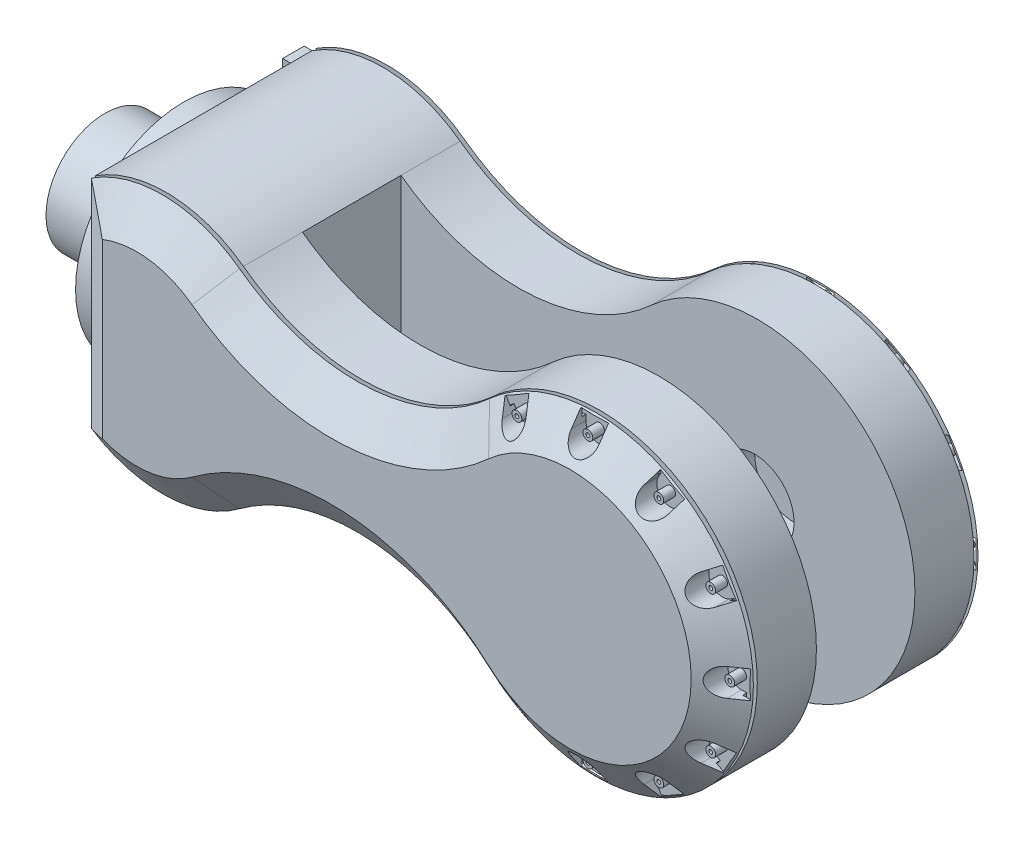
from build123d import *

# Parameters (mm, degrees)
SKETCH1_R           = 27.5
BOSS_EXTRUDE1_DEPTH = 5
BOSS_EXTRUDE2_DEPTH = 15
BOSS_EXTRUDE3_DEPTH = 1
BOSS_EXTRUDE4_DEPTH = 6.5
BOSS_EXTRUDE4_DRAFT = 55
CUT_EXTRUDE4_DEPTH  = 7.5
SKETCH8_R           = 1.25
SKETCH8_R_2         = 0.5
BOSS_EXTRUDE5_DEPTH = 3
CIRPATTERN1_COUNT   = 12
BOSS_EXTRUDE6_DEPTH = 12.5
SKETCH10_R          = 15
BOSS_EXTRUDE7_DEPTH = 20
SKETCH11_R          = 10
CUT_EXTRUDE5_DEPTH  = 10
SKETCH14_W          = 5.457021269
SKETCH14_H          = 2.223499654
BOSS_EXTRUDE9_DEPTH = 2


# Read off the part's stored shape, not the designer's step: Mirror1
with BuildPart() as part:
    # Sketch1 → Boss-Extrude1 (new body)
    with BuildSketch(Plane(origin=(0, 0, 0), x_dir=(0, 0, -1), z_dir=(1, 0, 0))):
        Circle(SKETCH1_R)
    extrude(amount=BOSS_EXTRUDE1_DEPTH)

    # Sketch2 → Boss-Extrude2 (add)
    with BuildSketch(Plane.XY.offset(-27.5)):
        with BuildLine():
            Line((5, -27.5), (5, 27.5))
            ThreePointArc((5, 27.5), (23.970158765, 32.852835372), (42.591392873, 26.389909536))
            ThreePointArc((42.591392873, 26.389909536), (74.89852823, 16.598932872), (106.064577143, 29.571658654))
            ThreePointArc((106.064577143, 29.571658654), (173, 0), (106.064577143, -29.571658654))
            ThreePointArc((106.064577143, -29.571658654), (74.89852823, -16.598932872), (42.591392873, -26.389909536))
            ThreePointArc((42.591392873, -26.389909536), (23.970158765, -32.852835372), (5, -27.5))
        make_face()
    extrude(amount=BOSS_EXTRUDE2_DEPTH)

    # Sketch3 → Boss-Extrude3 (add)
    with BuildSketch(Plane(origin=(0, 0, -27.5), x_dir=(-1, 0, 0), z_dir=(0, 0, -1))):
        with BuildLine():
            Line((-7.5, -26.113487238), (-7.5, 0))
            Line((-7.5, 0), (-7.5, 26.113487238))
            ThreePointArc((-7.5, 26.113487238), (-24.562227762, 30.326946106), (-41.101197588, 24.382593414))
            ThreePointArc((-41.101197588, 24.382593414), (-75.023689713, 14.102067917), (-107.748041072, 27.723429988))
            ThreePointArc((-107.748041072, 27.723429988), (-170.5, 0), (-107.748041072, -27.723429988))
            ThreePointArc((-107.748041072, -27.723429988), (-75.023689713, -14.102067917), (-41.101197588, -24.382593414))
            ThreePointArc((-41.101197588, -24.382593414), (-24.562227762, -30.326946106), (-7.5, -26.113487238))
        make_face()
    extrude(amount=BOSS_EXTRUDE3_DEPTH)


with BuildPart() as boss_extrude4_tool:
    # Sketch4 → Boss-Extrude4 (with draft: the straight prism first)
    with BuildSketch(Plane(origin=(0, 0, -28.5), x_dir=(-1, 0, 0), z_dir=(0, 0, -1))):
        with BuildLine():
            ThreePointArc((-42.591392873, -26.389909536), (-23.970158765, -32.852835372), (-5, -27.5))
            Line((-5, -27.5), (-5, 27.5))
            ThreePointArc((-5, 27.5), (-23.970158765, 32.852835372), (-42.591392873, 26.389909536))
            ThreePointArc((-42.591392873, 26.389909536), (-74.89852823, 16.598932872), (-106.064577143, 29.571658654))
            ThreePointArc((-106.064577143, 29.571658654), (-173, 0), (-106.064577143, -29.571658654))
            ThreePointArc((-106.064577143, -29.571658654), (-74.89852823, -16.598932872), (-42.591392873, -26.389909536))
        make_face()
    extrude(amount=BOSS_EXTRUDE4_DEPTH)
    # Boss-Extrude4: the draft: its side faces are tilted about the plane it starts from
    boss_extrude4_sides = [boss_extrude4_tool.faces().sort_by_distance(p)[0] for p in [
        (74.89852823, -16.598932872, -31.75),
        (23.970158765, -32.852835372, -31.75),
        (5, 0, -31.75),
        (23.970158765, 32.852835372, -31.75),
        (74.89852823, 16.598932872, -31.75),
        (173, 0, -31.75),
    ]]
    draft(boss_extrude4_sides, Plane(origin=(0, 0, -28.5), x_dir=(-1, 0, 0), z_dir=(0, 0, -1)), BOSS_EXTRUDE4_DRAFT)


with BuildPart() as part_1:
    add(part.part)

    # Boss-Extrude4: add boss_extrude4_tool
    add(boss_extrude4_tool.part)

    # Sketch7 → Cut-Extrude4 (cut)
    with BuildSketch(Plane(origin=(0, 0, -35), x_dir=(-1, 0, 0), z_dir=(0, 0, -1))):
        with BuildLine():
            Line((-172.5, -3.5), (-169, -3.5))
            ThreePointArc((-169, -3.5), (-165.5, 0), (-169, 3.5))
            Line((-169, 3.5), (-172.5, 3.5))
            Line((-172.5, 3.5), (-172.5, -3.5))
        make_face()
    cut_extrude4 = extrude(amount=-CUT_EXTRUDE4_DEPTH, mode=Mode.SUBTRACT)

    # Sketch8 → Boss-Extrude5 (add)
    with BuildSketch(Plane(origin=(0, 0, -27.5), x_dir=(-1, 0, 0), z_dir=(0, 0, -1))):
        with Locations(Location((-169, 0, 0), (0, 0, 180))):
            Circle(SKETCH8_R)
        with Locations((-169, 0)):
            Circle(SKETCH8_R_2, mode=Mode.SUBTRACT)
    boss_extrude5 = extrude(amount=BOSS_EXTRUDE5_DEPTH)

    # CirPattern1: Cut-Extrude4, Boss-Extrude5 ×12 about axis, 3 skipped
    cirpattern1_axis = Axis((133, 0, 0), (0, 0, -1))
    add([cut_extrude4.rotate(cirpattern1_axis, i * 360 / CIRPATTERN1_COUNT) for i in range(1, CIRPATTERN1_COUNT) if i not in (5, 6, 7)], mode=Mode.SUBTRACT)
    add([boss_extrude5.rotate(cirpattern1_axis, i * 360 / CIRPATTERN1_COUNT) for i in range(1, CIRPATTERN1_COUNT) if i not in (5, 6, 7)])

    # Sketch9 → Boss-Extrude6 (add)
    with BuildSketch(Plane.XY.offset(-12.5)):
        with BuildLine():
            Line((42.591392873, 26.389909536), (42.591392873, -26.389909536))
            ThreePointArc((42.591392873, -26.389909536), (23.970158765, -32.852835372), (5, -27.5))
            Line((5, -27.5), (5, 27.5))
            ThreePointArc((5, 27.5), (23.970158765, 32.852835372), (42.591392873, 26.389909536))
        make_face()
    extrude(amount=BOSS_EXTRUDE6_DEPTH)

    # Mirror1: part across plane


with BuildPart() as part_2:
    add(part_1.part)
    add(part_1.part.mirror(Plane.XY))

    # Sketch10 → Boss-Extrude7 (add)
    with BuildSketch(Plane.ZY):
        Circle(SKETCH10_R)
    extrude(amount=BOSS_EXTRUDE7_DEPTH)

    # Sketch11 → Cut-Extrude5 (cut)
    with BuildSketch(Plane(origin=(0, 0, 12.5), x_dir=(-1, 0, 0), z_dir=(0, 0, -1))):
        with Locations((-132.321300965, 0)):
            Circle(SKETCH11_R)
    cut_extrude5 = extrude(amount=-CUT_EXTRUDE5_DEPTH, mode=Mode.SUBTRACT)

    # Mirror2: Cut-Extrude5 across plane
    add(cut_extrude5.mirror(Plane.XY), mode=Mode.SUBTRACT)

    # Sketch14 → Boss-Extrude9 (add)
    with BuildSketch(Plane.ZY.offset(-5)):
        with Locations((-24.771489366, 26.388250173)):
            Rectangle(SKETCH14_W, SKETCH14_H)
    extrude(amount=BOSS_EXTRUDE9_DEPTH)


with BuildPart() as part_3:
    # Body-Move/Copy1: moved
    add(part_2.part.moved(Location((-132.321300965, 0, 0))))


solid = part_3.part
